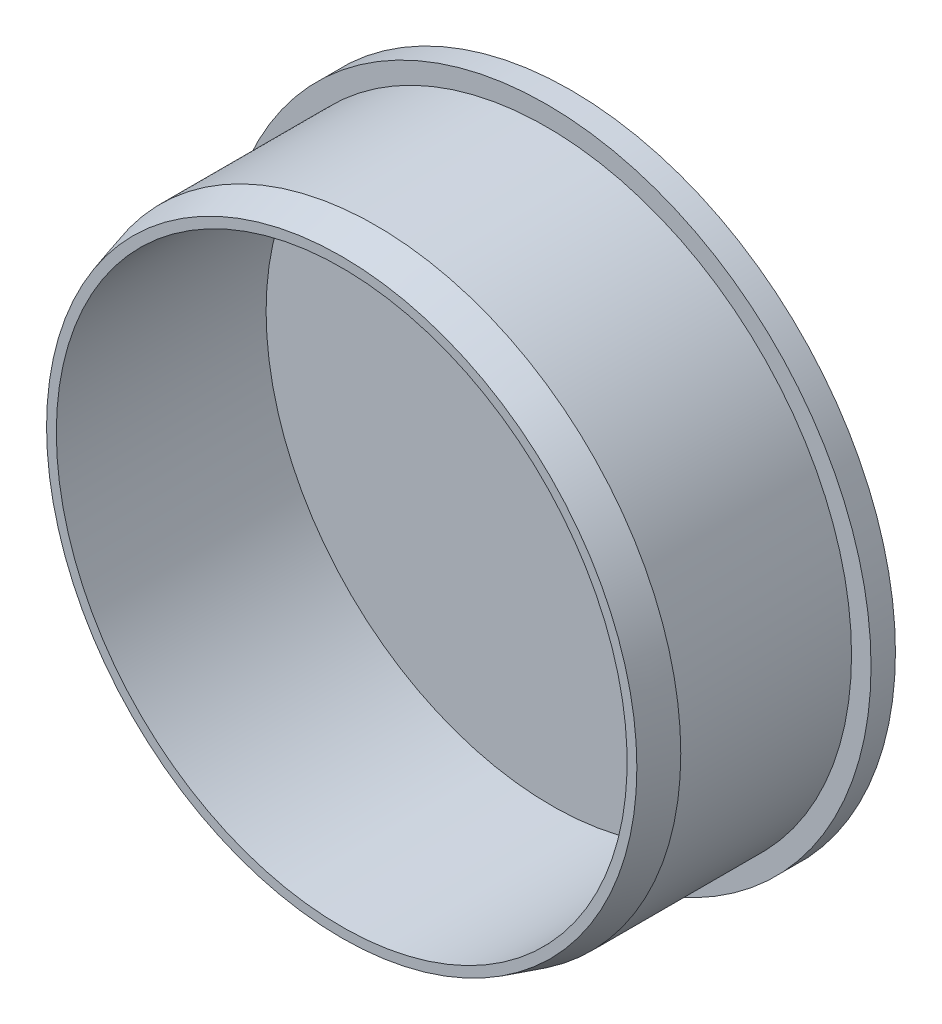
from build123d import *

# Parameters (mm, degrees)
SKIZZE2_R                       = 66.5
AUFSATZ_LINEAR_AUSTRAGEN2_DEPTH = 5
SKIZZE3_R                       = 62.5
AUFSATZ_LINEAR_AUSTRAGEN3_DEPTH = 42
WANDUNG1_T                      = -4
FASE1_SIZE                      = 7
FASE1_SIZE2                     = 2


with BuildPart() as part:
    # Skizze2 → Aufsatz-Linear austragen2 (new body)
    with BuildSketch(Plane.XY):
        Circle(SKIZZE2_R)
    extrude(amount=AUFSATZ_LINEAR_AUSTRAGEN2_DEPTH)

    # Skizze3 → Aufsatz-Linear austragen3 (add)
    with BuildSketch(Plane.XY.offset(5)):
        Circle(SKIZZE3_R)
    extrude(amount=AUFSATZ_LINEAR_AUSTRAGEN3_DEPTH)

    # Wandung1
    wandung1_openings = [part.faces().sort_by_distance(p)[0] for p in [
        (0, 0, 47),
    ]]
    offset(amount=WANDUNG1_T, openings=wandung1_openings, kind=Kind.INTERSECTION)

    # Fase1
    fase1_edges = [part.edges().sort_by_distance(p)[0] for p in [
        (-62.5, 0, 47),
    ]]
    fase1_side = [part.faces().sort_by_distance(p)[0] for p in [
        (-62.5, 0, 26),
    ]]
    chamfer(fase1_edges, length=FASE1_SIZE, length2=FASE1_SIZE2, reference=fase1_side[0])


solid = part.part
